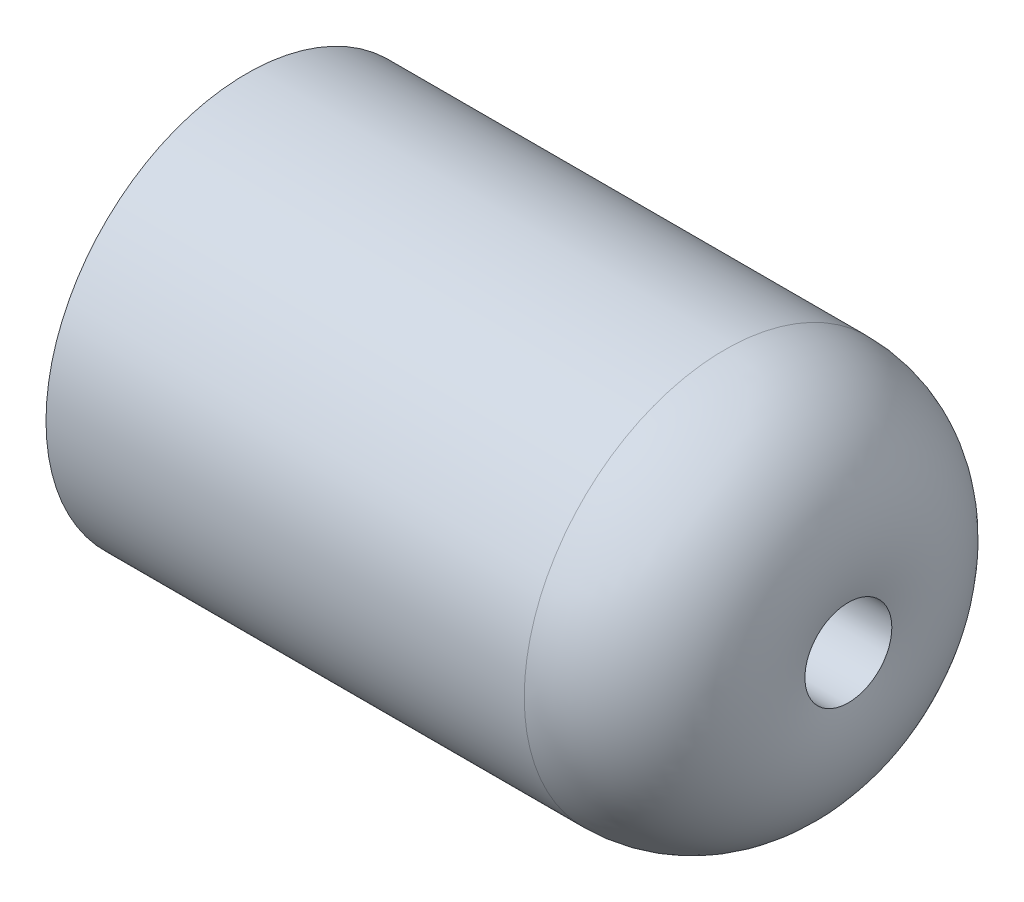
from build123d import *


with BuildPart() as part:
    # Sketch1 → Revolve1 (revolve)
    with BuildSketch(Plane.XY):
        with BuildLine():
            Line((0, 0.8255), (11.43, 0.8255))
            ThreePointArc((11.43, 0.8255), (10.981990266, 2.887726998), (9.083858178, 3.81))
            Line((9.083858178, 3.81), (0, 3.81))
            Line((0, 3.81), (0, 0.8255))
        make_face()
    revolve(axis=Axis((0, 0, 0), (-1, 0, 0)))


solid = part.part
